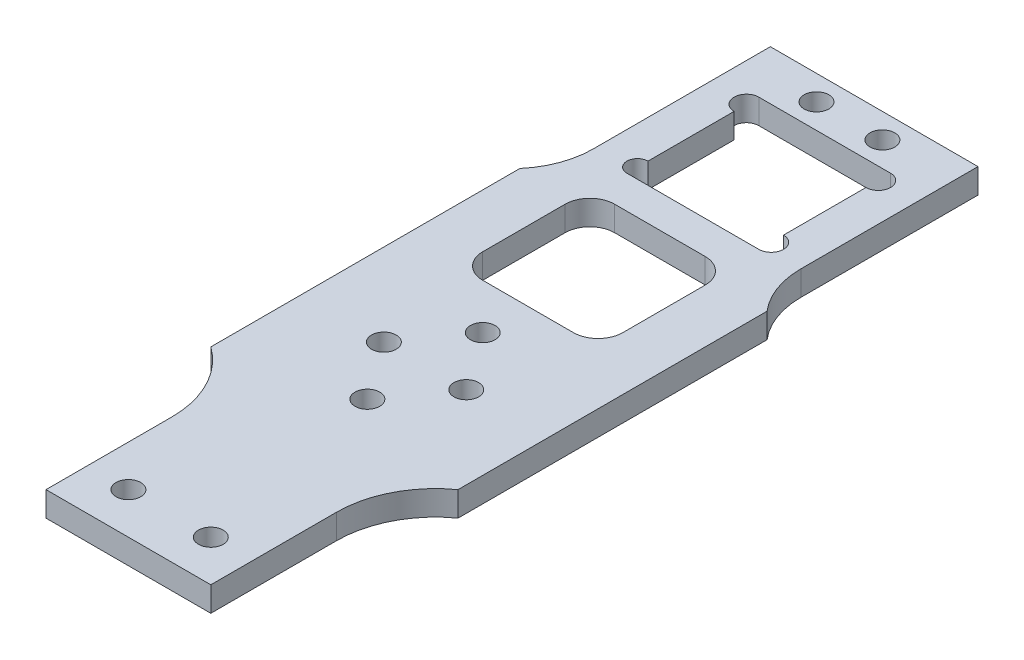
from build123d import *

# Parameters (mm, degrees)
SKETCH_1_W          = 25.2
SKETCH_1_H          = 28
EXTRUDE_1_DEPTH     = 3
SKETCH_4_R          = 1.5
SKETCH_4_W          = 16
SKETCH_4_H          = 16
CUT_EXTRUDE_3_DEPTH = 20.072493282
SKETCH_6_W          = 30
SKETCH_6_H          = 37.5
EXTRUDE_2_DEPTH     = 3
SKETCH_7_R          = 1.5
CUT_EXTRUDE_5_DEPTH = 54.723830839
FILLET_1_R          = 10
SKETCH_8_W          = 17
SKETCH_8_H          = 16
CUT_EXTRUDE_6_DEPTH = 54.723830839
FILLET_2_R          = 3
SKETCH_5_R          = 1.5
SKETCH_5_R_2        = 1.275
CUT_EXTRUDE_7_DEPTH = 10
SKETCH_9_W          = 20
SKETCH_9_H          = 3
EXTRUDE_3_DEPTH     = 25
FILLET_3_R          = 12
SKETCH_12_R         = 1.5
CUT_EXTRUDE_9_DEPTH = 79.014421744


with BuildPart() as part:
    # 草图1 → 凸台-拉伸1 (new body)
    with BuildSketch(Plane(origin=(0, 0, 0), x_dir=(1, 0, 0), z_dir=(0, 1, 0))):
        Rectangle(SKETCH_1_W, SKETCH_1_H)
    extrude(amount=EXTRUDE_1_DEPTH)

    # 草图4 → 切除-拉伸3 (cut, through all)
    with BuildSketch(Plane(origin=(0, 3, 0), x_dir=(1, 0, 0), z_dir=(0, 1, 0))):
        with Locations(Location((4, 11, 0), (0, 0, 270))):
            Circle(SKETCH_4_R)
        with Locations(Location((-4, 11, 0), (0, 0, 270))):
            Circle(SKETCH_4_R)
        Rectangle(SKETCH_4_W, SKETCH_4_H)
    extrude(amount=-CUT_EXTRUDE_3_DEPTH, mode=Mode.SUBTRACT)

    # 草图6 → 凸台-拉伸2 (add)
    with BuildSketch(Plane(origin=(0, 3, 0), x_dir=(1, 0, 0), z_dir=(0, 1, 0))):
        with Locations((0, -32.75)):
            Rectangle(SKETCH_6_W, SKETCH_6_H)
    extrude(amount=-EXTRUDE_2_DEPTH)

    # 草图7 → 切除-拉伸5 (cut, through all)
    with BuildSketch(Plane(origin=(0, 3, 0), x_dir=(1, 0, 0), z_dir=(0, 1, 0))):
        with Locations(Location((0, -33.5, 0), (0, 0, 270))):
            Circle(SKETCH_7_R)
        with Locations(Location((-5, -40.5, 0), (0, 0, 270))):
            Circle(SKETCH_7_R)
        with Locations(Location((5, -40.5, 0), (0, 0, 270))):
            Circle(SKETCH_7_R)
        with Locations(Location((0, -47.5, 0), (0, 0, 270))):
            Circle(SKETCH_7_R)
    extrude(amount=-CUT_EXTRUDE_5_DEPTH, mode=Mode.SUBTRACT)

    # 圆角1
    # the kernel refuses this fillet: 10 mm, written as the material it adds along each edge
    with BuildSketch(Plane(origin=(12.6, 0, 14), x_dir=(0, 0, -1), z_dir=(0, 1, 0))) as fillet_1_piece_1:
        with BuildLine():
            CenterArc((6.499230724, -10), FILLET_1_R, 90, 40.535802111)
            Line((0, -2.4), (-0.129984614, -2.248))
            ThreePointArc((-0.129984614, -2.248), (-0.2, -1.2), (-0.2, 0))
            Line((-0.2, 0), (0, 0.2))
            Line((0, 0.2), (6.499230724, 0.2))
            Line((6.499230724, 0.2), (6.499230724, 0))
        make_face()
    extrude(amount=3)
    with BuildSketch(Plane(origin=(-12.6, 0, 14), x_dir=(-1, 0, 0), z_dir=(0, 1, 0))) as fillet_1_piece_2:
        with BuildLine():
            CenterArc((10, -6.499230724), FILLET_1_R, 139.464197889, 40.535802111)
            Line((0, -6.499230724), (-0.2, -6.499230724))
            Line((-0.2, -6.499230724), (-0.2, 0))
            Line((-0.2, 0), (0, 0.2))
            ThreePointArc((0, 0.2), (1.2, 0.2), (2.248, 0.129984614))
            Line((2.248, 0.129984614), (2.4, 0))
        make_face()
    extrude(amount=3)

    # 草图8 → 切除-拉伸6 (cut, through all)
    with BuildSketch(Plane(origin=(0, 3, 0), x_dir=(1, 0, 0), z_dir=(0, 1, 0))):
        with Locations((0, -20)):
            Rectangle(SKETCH_8_W, SKETCH_8_H)
    extrude(amount=-CUT_EXTRUDE_6_DEPTH, mode=Mode.SUBTRACT)

    # 圆角2
    fillet_2_edges = [part.edges().sort_by_distance(p)[0] for p in [
        (8.5, 1.5, 12),
        (8.5, 1.5, 28),
        (-8.5, 1.5, 28),
        (-8.5, 1.5, 12),
    ]]
    fillet(fillet_2_edges, radius=FILLET_2_R)

    # 草图5 → 切除-拉伸7 (cut)
    with BuildSketch(Plane(origin=(0, 3, 0), x_dir=(1, 0, 0), z_dir=(0, 1, 0))):
        with Locations((8, 6.5)):
            Circle(SKETCH_5_R)
        with Locations((-8, 6.5)):
            Circle(SKETCH_5_R)
        with Locations((8, -6.5)):
            Circle(SKETCH_5_R)
        with Locations((-8, -6.725)):
            Circle(SKETCH_5_R_2)
    extrude(amount=-CUT_EXTRUDE_7_DEPTH, mode=Mode.SUBTRACT)

    # 草图9 → 凸台-拉伸3 (add)
    with BuildSketch(Plane.XY.offset(51.5)):
        with Locations((0, 1.5)):
            Rectangle(SKETCH_9_W, SKETCH_9_H)
    extrude(amount=EXTRUDE_3_DEPTH)

    # 圆角3
    # the kernel refuses this fillet: 12 mm, written as the material it adds along each edge
    with BuildSketch(Plane(origin=(10, 3, 51.5), x_dir=(1, 0, 0), z_dir=(0, -1, 0)), Plane(origin=(-10, 0, 51.5), x_dir=(-1, 0, 0), z_dir=(0, 1, 0))) as fillet_3_piece_1:
        with BuildLine():
            CenterArc((12, 9.746794345), FILLET_3_R, 180, 54.314665287)
            Line((0, 9.746794345), (-0.24, 9.746794345))
            Line((-0.24, 9.746794345), (-0.24, 0))
            Line((-0.24, 0), (0, -0.24))
            ThreePointArc((0, -0.24), (2.5, -0.24), (4.86, -0.194935887))
            Line((4.86, -0.194935887), (5, 0))
        make_face()
    extrude(amount=3)

    # 草图12 → 切除-拉伸9 (cut, through all)
    with BuildSketch(Plane(origin=(0, 3, 0), x_dir=(1, 0, 0), z_dir=(0, 1, 0))):
        with Locations(Location((5, -71.5, 0), (0, 0, 270))):
            Circle(SKETCH_12_R)
        with Locations(Location((-5, -71.5, 0), (0, 0, 270))):
            Circle(SKETCH_12_R)
    extrude(amount=-CUT_EXTRUDE_9_DEPTH, mode=Mode.SUBTRACT)


solid = part.part
